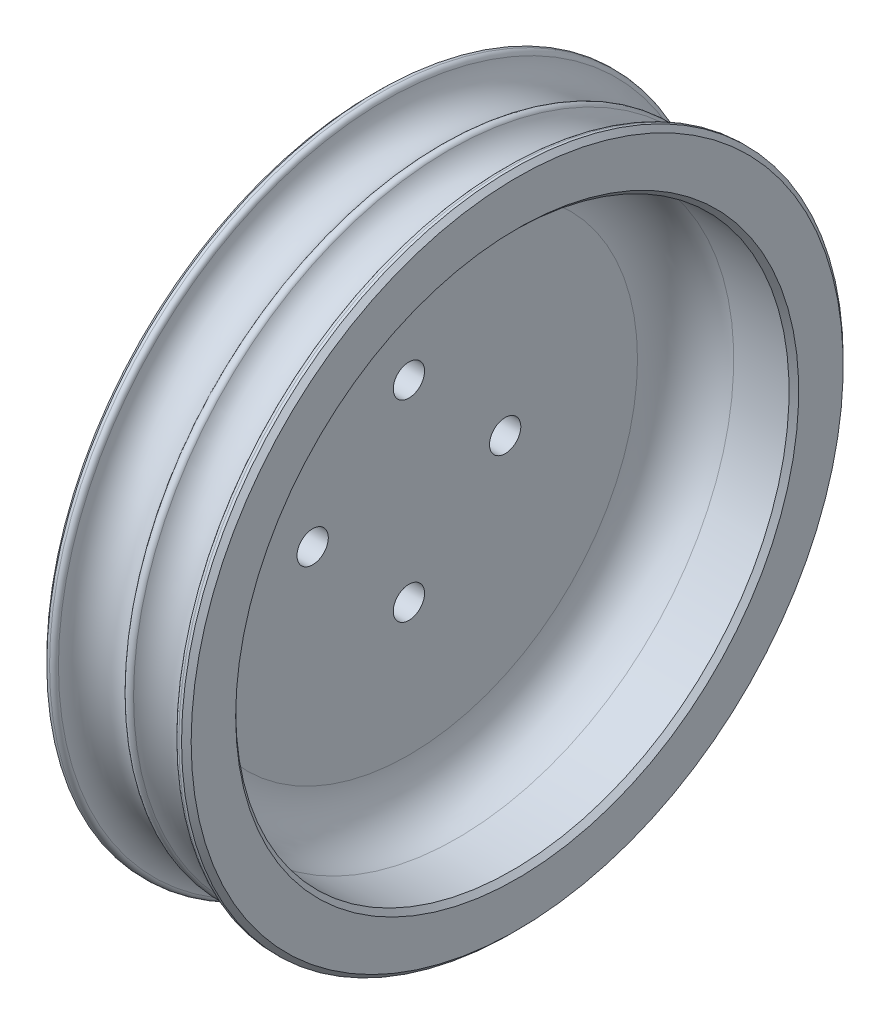
from build123d import *

# Parameters (mm, degrees)
FILLET_1_R      = 0.4
SKETCH_4_R      = 23
SKETCH_4_R_2    = 1.3
EXTRUDE_1_DEPTH = 3
CHAMFER_1_SIZE  = 0.4
FILLET_2_R      = 4


with BuildPart() as part:
    # 草图1 → 旋转1 (revolve)
    with BuildSketch(Plane.XY):
        with BuildLine():
            Line((6, 23), (0, 23))
            Line((0, 23), (-6, 23))
            Line((-6, 23), (-6, 27.5))
            Line((-6, 27.5), (-5, 27.5))
            ThreePointArc((-5, 27.5), (-2.5, 25), (0, 27.5))
            ThreePointArc((0, 27.5), (2.5, 25), (5, 27.5))
            Line((5, 27.5), (6, 27.5))
            Line((6, 27.5), (6, 23))
        make_face()
    revolve(axis=Axis((-16.580648815, 0, 0), (1, 0, 0)))

    # 圆角1
    fillet_1_edges = [part.edges().sort_by_distance(p)[0] for p in [
        (-5, -27.5, 0),
        (5, -27.5, 0),
        (0, -27.5, 0),
    ]]
    fillet(fillet_1_edges, radius=FILLET_1_R)

    # 草图4 → 凸台-拉伸1 (add)
    with BuildSketch(Plane.ZY.offset(6)):
        Circle(SKETCH_4_R)
        with Locations((8, 0)):
            Circle(SKETCH_4_R_2, mode=Mode.SUBTRACT)
        with Locations((0, -8)):
            Circle(SKETCH_4_R_2, mode=Mode.SUBTRACT)
        with Locations((-8, 0)):
            Circle(SKETCH_4_R_2, mode=Mode.SUBTRACT)
        with Locations((0, 8)):
            Circle(SKETCH_4_R_2, mode=Mode.SUBTRACT)
    extrude(amount=-EXTRUDE_1_DEPTH)

    # 倒角1
    chamfer_1_edges = [part.edges().sort_by_distance(p)[0] for p in [
        (6, -23, 0),
        (6, -27.5, 0),
        (-6, -27.5, 0),
        (-6, 0, 6.7),
        (-6, -8, -1.3),
        (-6, 0, -9.3),
        (-6, 8, -1.3),
    ]]
    chamfer(chamfer_1_edges, length=CHAMFER_1_SIZE)

    # 圆角2
    fillet_2_edges = [part.edges().sort_by_distance(p)[0] for p in [
        (-3, -23, 0),
    ]]
    fillet(fillet_2_edges, radius=FILLET_2_R)


solid = part.part
